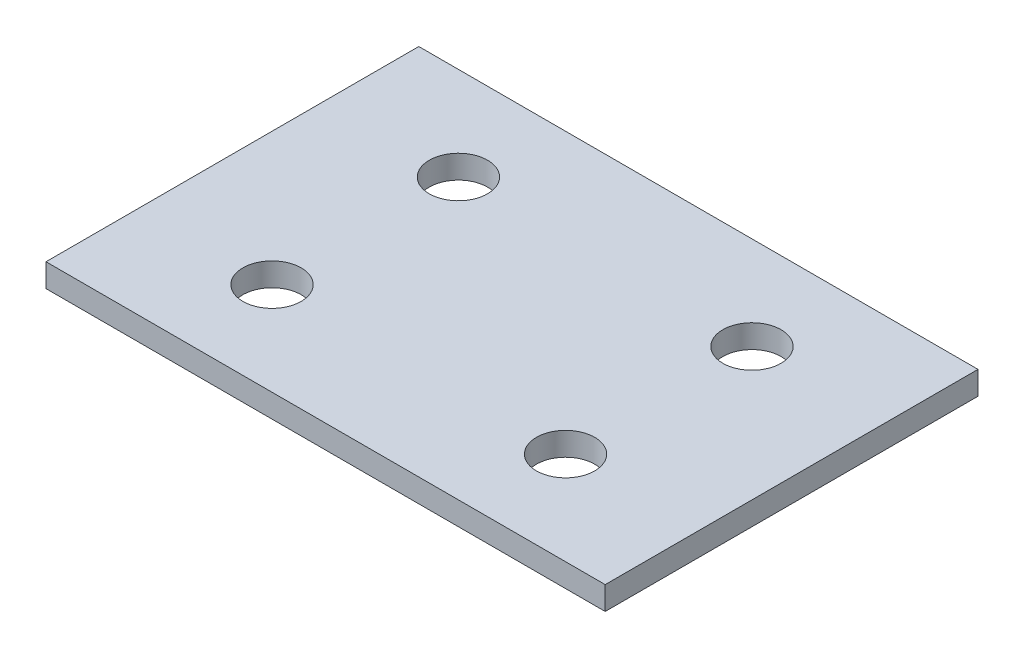
from build123d import *

# Parameters (mm, degrees)
SKETCH1_W           = 76.2
SKETCH1_H           = 50.8
BOSS_EXTRUDE1_DEPTH = 3.175
SKETCH3_R           = 3.96875
CUT_EXTRUDE1_DEPTH  = 92.636022529


with BuildPart() as part:
    # Sketch1 → Boss-Extrude1 (new body)
    with BuildSketch(Plane(origin=(0, 0, 0), x_dir=(1, 0, 0), z_dir=(0, 1, 0))):
        with Locations((38.1, 25.4)):
            Rectangle(SKETCH1_W, SKETCH1_H)
    extrude(amount=BOSS_EXTRUDE1_DEPTH)

    # Sketch3 → Cut-Extrude1 (cut, through all)
    with BuildSketch(Plane(origin=(0, 3.175, 0), x_dir=(1, 0, 0), z_dir=(0, 1, 0))):
        with Locations((18.1, 38.1)):
            Circle(SKETCH3_R)
        with Locations((18.1, 12.7)):
            Circle(SKETCH3_R)
        with Locations((58.1, 38.1)):
            Circle(SKETCH3_R)
        with Locations((58.1, 12.7)):
            Circle(SKETCH3_R)
    extrude(amount=-CUT_EXTRUDE1_DEPTH, mode=Mode.SUBTRACT)


solid = part.part
